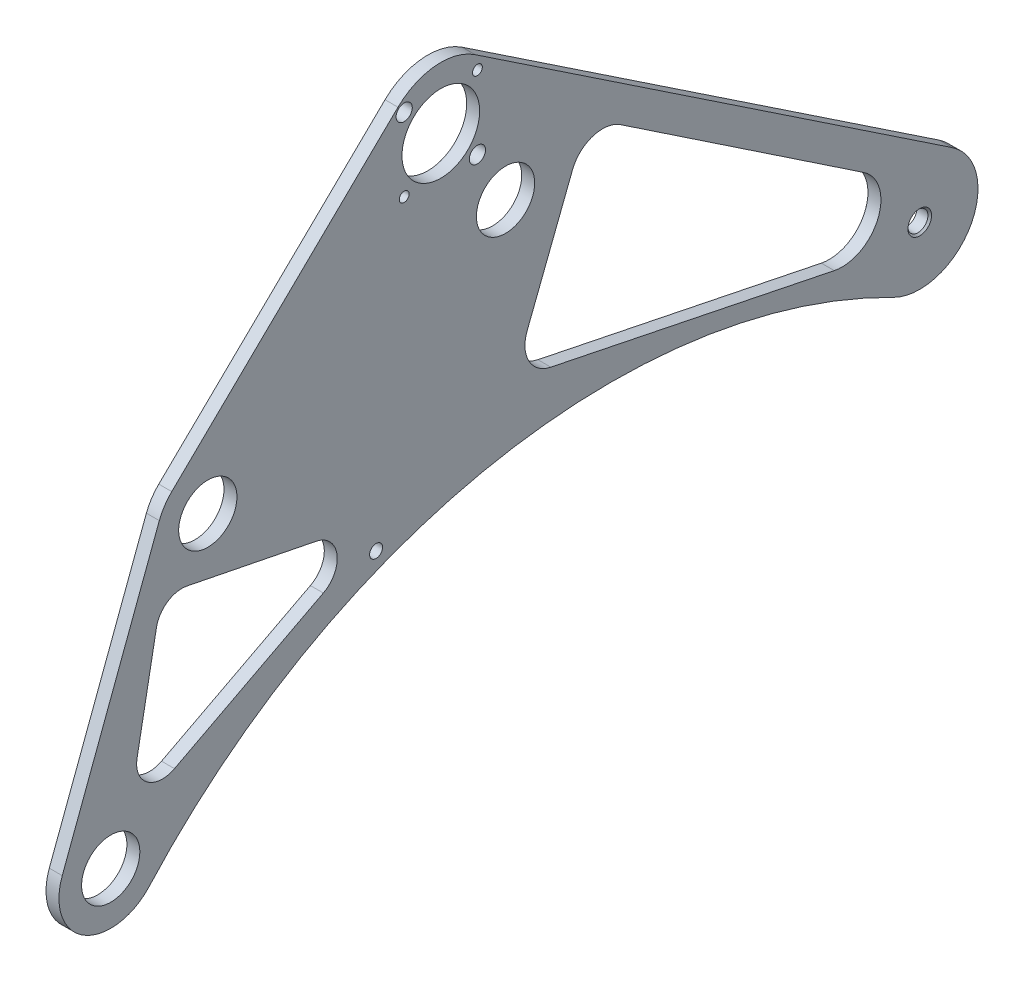
from build123d import *

# Parameters (mm, degrees)
BOSS_EXTRUDE1_DEPTH               = 6.35
CUT_EXTRUDE1_REACH                = 463.209
SKETCH3_R                         = 14.2875
SKETCH3_R_2                       = 19.05
SKETCH3_R_3                       = 2.413
SKETCH3_R_4                       = 3.96875
F_3_8_CLEARANCE_HOLE2_D           = 9.8044
F_3_8_CLEARANCE_HOLE2_CSINK_D     = 11.58748
F_3_8_CLEARANCE_HOLE2_CSINK_ANGLE = 90
F_1_4_0_2500_DOWEL_HOLE2_D        = 6.35
CUT_EXTRUDE2_DEPTH                = 462.208770751


with BuildPart() as part:
    # Sketch2 → Boss-Extrude1 (new body)
    with BuildSketch(Plane(origin=(0, 0, 0), x_dir=(0, 0, -1), z_dir=(1, 0, 0))):
        with BuildLine():
            Line((-420.65776111, -67.281464584), (-373.03276111, 59.718535416))
            ThreePointArc((-373.03276111, 59.718535416), (-370.505449055, 64.705606261), (-366.948304567, 69.018946606))
            Line((-366.948304567, 69.018946606), (-255.966736674, 176.828999095))
            ThreePointArc((-255.966736674, 176.828999095), (-237.683735505, 185.232360415), (-218.184119534, 180.26752505))
            Line((-218.184119534, 180.26752505), (15.883465704, 23.753865837))
            ThreePointArc((15.883465704, 23.753865837), (24.649476553, -14.454547059), (-12.975284095, -25.459234624))
            ThreePointArc((-12.975284095, -25.459234624), (-206.983757432, 2.660555148), (-377.990639572, -93.186492612))
            ThreePointArc((-377.990639572, -93.186492612), (-410.057040874, -97.911605155), (-420.65776111, -67.281464584))
        make_face()
    extrude(amount=BOSS_EXTRUDE1_DEPTH)

    # Sketch3 → Cut-Extrude1 (cut, up to next)
    with BuildSketch(Plane(origin=(6.35, 0, 0), x_dir=(0, 0, -1), z_dir=(1, 0, 0)), mode=Mode.PRIVATE) as cut_extrude1_sk1:
        with Locations((-203.2, 111.125)):
            Circle(SKETCH3_R)
    cut_extrude1_tool1 = extrude(cut_extrude1_sk1.sketch, amount=-CUT_EXTRUDE1_REACH, mode=Mode.PRIVATE) & part.part
    # Sketch3 → Cut-Extrude1 (cut, up to next)
    with BuildSketch(Plane(origin=(6.35, 0, 0), x_dir=(0, 0, -1), z_dir=(1, 0, 0)), mode=Mode.PRIVATE) as cut_extrude1_sk2:
        with Locations((-349.25, 50.8)):
            Circle(SKETCH3_R)
    cut_extrude1_tool2 = extrude(cut_extrude1_sk2.sketch, amount=-CUT_EXTRUDE1_REACH, mode=Mode.PRIVATE) & part.part
    # Sketch3 → Cut-Extrude1 (cut, up to next)
    with BuildSketch(Plane(origin=(6.35, 0, 0), x_dir=(0, 0, -1), z_dir=(1, 0, 0)), mode=Mode.PRIVATE) as cut_extrude1_sk3:
        with Locations((-396.875, -76.2)):
            Circle(SKETCH3_R)
    cut_extrude1_tool3 = extrude(cut_extrude1_sk3.sketch, amount=-CUT_EXTRUDE1_REACH, mode=Mode.PRIVATE) & part.part
    # Sketch3 → Cut-Extrude1 (cut, up to next)
    with BuildSketch(Plane(origin=(6.35, 0, 0), x_dir=(0, 0, -1), z_dir=(1, 0, 0)), mode=Mode.PRIVATE) as cut_extrude1_sk4:
        with Locations((-234.95, 155.194)):
            Circle(SKETCH3_R_2)
    cut_extrude1_tool4 = extrude(cut_extrude1_sk4.sketch, amount=-CUT_EXTRUDE1_REACH, mode=Mode.PRIVATE) & part.part
    # Sketch3 → Cut-Extrude1 (cut, up to next)
    with BuildSketch(Plane(origin=(6.35, 0, 0), x_dir=(0, 0, -1), z_dir=(1, 0, 0)), mode=Mode.PRIVATE) as cut_extrude1_sk5:
        with Locations((-252.910512242, 137.233487758)):
            Circle(SKETCH3_R_3)
    cut_extrude1_tool5 = extrude(cut_extrude1_sk5.sketch, amount=-CUT_EXTRUDE1_REACH, mode=Mode.PRIVATE) & part.part
    # Sketch3 → Cut-Extrude1 (cut, up to next)
    with BuildSketch(Plane(origin=(6.35, 0, 0), x_dir=(0, 0, -1), z_dir=(1, 0, 0)), mode=Mode.PRIVATE) as cut_extrude1_sk6:
        with Locations((-216.989487758, 137.233487758)):
            Circle(SKETCH3_R_4)
    cut_extrude1_tool6 = extrude(cut_extrude1_sk6.sketch, amount=-CUT_EXTRUDE1_REACH, mode=Mode.PRIVATE) & part.part
    # Sketch3 → Cut-Extrude1 (cut, up to next)
    with BuildSketch(Plane(origin=(6.35, 0, 0), x_dir=(0, 0, -1), z_dir=(1, 0, 0)), mode=Mode.PRIVATE) as cut_extrude1_sk7:
        with Locations((-216.989487758, 173.154512242)):
            Circle(SKETCH3_R_3)
    cut_extrude1_tool7 = extrude(cut_extrude1_sk7.sketch, amount=-CUT_EXTRUDE1_REACH, mode=Mode.PRIVATE) & part.part
    # Sketch3 → Cut-Extrude1 (cut, up to next)
    with BuildSketch(Plane(origin=(6.35, 0, 0), x_dir=(0, 0, -1), z_dir=(1, 0, 0)), mode=Mode.PRIVATE) as cut_extrude1_sk8:
        with Locations((-252.910512242, 173.154512242)):
            Circle(SKETCH3_R_4)
    cut_extrude1_tool8 = extrude(cut_extrude1_sk8.sketch, amount=-CUT_EXTRUDE1_REACH, mode=Mode.PRIVATE) & part.part
    add(cut_extrude1_tool1.solids().sort_by_distance((6.35, 111.125, 203.2))[0], mode=Mode.SUBTRACT)
    add(cut_extrude1_tool2.solids().sort_by_distance((6.35, 50.8, 349.25))[0], mode=Mode.SUBTRACT)
    add(cut_extrude1_tool3.solids().sort_by_distance((6.35, -76.2, 396.875))[0], mode=Mode.SUBTRACT)
    add(cut_extrude1_tool4.solids().sort_by_distance((6.35, 155.194, 234.95))[0], mode=Mode.SUBTRACT)
    add(cut_extrude1_tool5.solids().sort_by_distance((6.35, 137.233488, 252.910512))[0], mode=Mode.SUBTRACT)
    add(cut_extrude1_tool6.solids().sort_by_distance((6.35, 137.233488, 216.989488))[0], mode=Mode.SUBTRACT)
    add(cut_extrude1_tool7.solids().sort_by_distance((6.35, 173.154512, 216.989488))[0], mode=Mode.SUBTRACT)
    add(cut_extrude1_tool8.solids().sort_by_distance((6.35, 173.154512, 252.910512))[0], mode=Mode.SUBTRACT)

    # 3/8 Clearance Hole2 (through all)
    with Locations(Plane(origin=(6.35, 0, 0), x_dir=(0, 0, -1), z_dir=(1, 0, 0))):
        with Locations((0, 0)):
            CounterSinkHole(F_3_8_CLEARANCE_HOLE2_D / 2, F_3_8_CLEARANCE_HOLE2_CSINK_D / 2, counter_sink_angle=F_3_8_CLEARANCE_HOLE2_CSINK_ANGLE)

    # 1/4 (0.2500) Dowel Hole2 (through all)
    with Locations(Plane(origin=(6.35, 0, 0), x_dir=(0, 0, -1), z_dir=(1, 0, 0))):
        with Locations((-266.7, -6.35)):
            Hole(F_1_4_0_2500_DOWEL_HOLE2_D / 2)

    # Sketch14 → Cut-Extrude2 (cut, through all)
    with BuildSketch(Plane(origin=(6.35, 0, 0), x_dir=(0, 0, -1), z_dir=(1, 0, 0))):
        with BuildLine():
            Line((-365.600411715, -49.359627546), (-292.575411715, -11.259627546))
            ThreePointArc((-292.575411715, -11.259627546), (-285.877370021, 1.794150333), (-295.959325084, 12.453374581))
            Line((-295.959325084, 12.453374581), (-359.459325084, 25.153374581))
            ThreePointArc((-359.459325084, 25.153374581), (-369.058218075, 23.224411423), (-374.432476774, 15.040464395))
            Line((-374.432476774, 15.040464395), (-383.957476774, -35.759535605))
            ThreePointArc((-383.957476774, -35.759535605), (-379.035203223, -48.304573838), (-365.600411715, -49.359627546))
        make_face()
        with BuildLine():
            Line((-146.737196738, 114.787450796), (-27.494636085, 34.874940955))
            ThreePointArc((-27.494636085, 34.874940955), (-20.526601666, 11.696213832), (-41.926015549, 0.388164479))
            Line((-41.926015549, 0.388164479), (-180.988346291, 28.898470399))
            ThreePointArc((-180.988346291, 28.898470399), (-191.74040826, 36.85522268), (-192.595574161, 50.203834396))
            Line((-192.595574161, 50.203834396), (-170.370574161, 107.353834396))
            ThreePointArc((-170.370574161, 107.353834396), (-160.338236475, 116.743553192), (-146.737196738, 114.787450796))
        make_face()
    extrude(amount=-CUT_EXTRUDE2_DEPTH, mode=Mode.SUBTRACT)


solid = part.part
